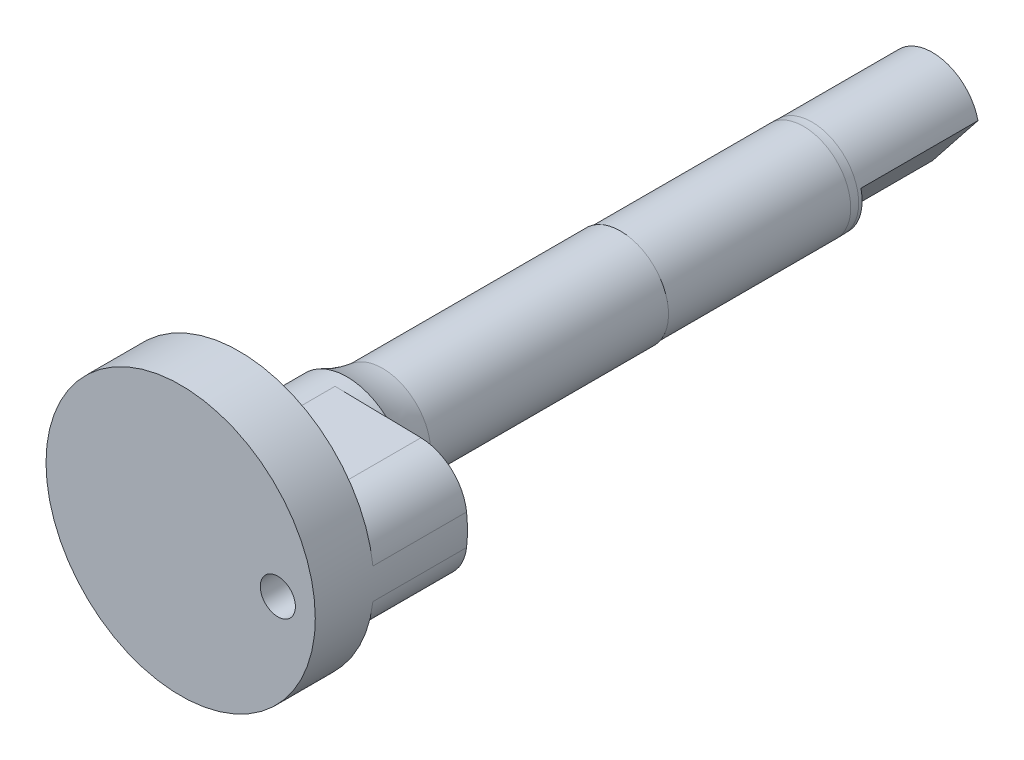
from build123d import *

# Parameters (mm, degrees)
SKETCH1_R               = 5
BOSS_EXTRUDE1_DEPTH     = 100
SKETCH2_R               = 11.5
BOSS_EXTRUDE2_DEPTH     = 5
SKETCH3_R               = 1.5
BOSS_EXTRUDE3_DEPTH     = 5
BOSS_EXTRUDE4_START     = 8
BOSS_EXTRUDE4_DEPTH     = 8
CUT_EXTRUDE2_DEPTH      = 8
CUT_EXTRUDE4_DEPTH      = 134.839635872
CUT_EXTRUDE4_DEPTH_BACK = 134.839635872
SKETCH7_W               = 13.423809299
SKETCH7_H               = 65.791523209
CUT_EXTRUDE5_DEPTH      = 48.105089111
CUT_EXTRUDE5_DEPTH_BACK = 48.105089111
SKETCH8_R               = 1.5
SKETCH9_R               = 5
SKETCH9_R_2             = 4.025
CUT_EXTRUDE6_DEPTH      = 25
FILLET1_R               = 10
BOSS_EXTRUDE5_START     = 25
SKETCH10_R              = 4.025
BOSS_EXTRUDE5_DEPTH     = 25
CUT_EXTRUDE7_DEPTH      = 10
SKETCH12_R              = 4.025
SKETCH12_R_2            = 4
CUT_EXTRUDE8_DEPTH      = 11
FILLET2_R               = 10
SKETCH13_R              = 4.105
SKETCH13_R_2            = 4.025
BOSS_EXTRUDE6_DEPTH     = 20
BOSS_EXTRUDE7_START     = 5
SKETCH14_R              = 4.105
BOSS_EXTRUDE7_DEPTH     = 5


with BuildPart() as part:
    # Sketch1 → Boss-Extrude1 (new body)
    with BuildSketch(Plane.XY):
        Circle(SKETCH1_R)
    extrude(amount=BOSS_EXTRUDE1_DEPTH)

    # Sketch2 → Boss-Extrude2 (add)
    with BuildSketch(Plane.XY.offset(100)):
        Circle(SKETCH2_R)
    extrude(amount=BOSS_EXTRUDE2_DEPTH)

    # Sketch3 → Boss-Extrude3 (add)
    with BuildSketch(Plane.XY.offset(105)):
        with Locations((8.302947015, 0)):
            Circle(SKETCH3_R)
    extrude(amount=BOSS_EXTRUDE3_DEPTH)

    # Sketch5 → Boss-Extrude4 (add)
    with BuildSketch(Plane(origin=(0, 0, 100), x_dir=(-1, 0, 0), z_dir=(0, 0, -1)).offset(BOSS_EXTRUDE4_START)):
        with BuildLine():
            Line((-10.45001903, 4.800739762), (0, 5))
            ThreePointArc((0, 5), (4.99977072, -0.04788268), (-0.095760969, -4.9990829))
            Line((-0.095760969, -4.9990829), (-10.45001903, -4.800739762))
            ThreePointArc((-10.45001903, -4.800739762), (-11.5, 0), (-10.45001903, 4.800739762))
        make_face()
    extrude(amount=-BOSS_EXTRUDE4_DEPTH)

    # Sketch6 → Cut-Extrude2 (cut)
    with BuildSketch(Plane(origin=(0, 0, 92), x_dir=(-1, 0, 0), z_dir=(0, 0, -1))):
        with BuildLine():
            ThreePointArc((-11.187749919, 2.661625773), (-11.326245042, 1.991525355), (-11.424640936, 1.314374177))
            ThreePointArc((-11.424640936, 1.314374177), (-10.141082355, 3.817380419), (-7.527110609, 4.856473577))
            Line((-7.527110609, 4.856473577), (-10.45001903, 4.800739762))
            ThreePointArc((-10.45001903, 4.800739762), (-10.871624232, 3.749371489), (-11.187749919, 2.661625773))
        make_face()
        with BuildLine():
            ThreePointArc((-11.424595573, -1.314768419), (-10.141131578, -3.817565911), (-7.527431975, -4.856723984))
            Line((-7.527431975, -4.856723984), (-10.45001903, -4.800739762))
            ThreePointArc((-10.45001903, -4.800739762), (-11.07531896, -3.09633815), (-11.424595573, -1.314768419))
        make_face()
    extrude(amount=-CUT_EXTRUDE2_DEPTH, mode=Mode.SUBTRACT)

    # Sketch7 → Cut-Extrude4 (cut, two sides: drawn at the far end of the back side and taken through both)
    with BuildSketch(Plane(origin=(-96.480203858, -4.620399557, 77.417416795), x_dir=(0.40721461787547164, -0.9133324996892062, 6.240488345448587e-15), z_dir=(0.9133324996892062, 0.40721461787547164, -3.9305527970726e-15)).offset(-CUT_EXTRUDE4_DEPTH_BACK)):
        with Locations((36.58009292, 44.521655191)):
            Rectangle(SKETCH7_W, SKETCH7_H)
    extrude(amount=CUT_EXTRUDE4_DEPTH + CUT_EXTRUDE4_DEPTH_BACK, mode=Mode.SUBTRACT)

    # Sketch8 → Cut-Extrude5 (cut, two sides: drawn at the far end of the back side and taken through both)
    with BuildSketch(Plane.XY.offset(110).offset(-CUT_EXTRUDE5_DEPTH_BACK)):
        with Locations((8.302947015, 0)):
            Circle(SKETCH8_R)
    extrude(amount=CUT_EXTRUDE5_DEPTH + CUT_EXTRUDE5_DEPTH_BACK, mode=Mode.SUBTRACT)

    # Sketch9 → Cut-Extrude6 (cut)
    with BuildSketch(Plane(origin=(0, 0, 65.791523209), x_dir=(-1, 0, 0), z_dir=(0, 0, -1))):
        with Locations(Location((0, 0, 0), (0, 0, 90))):
            Circle(SKETCH9_R)
        with Locations(Location((0, 0, 0), (0, 0, 90))):
            Circle(SKETCH9_R_2, mode=Mode.SUBTRACT)
    extrude(amount=-CUT_EXTRUDE6_DEPTH, mode=Mode.SUBTRACT)

    # Fillet1
    # the kernel refuses this fillet: 10 mm, written as the material it adds along each edge
    with BuildSketch(Plane(origin=(0, 0, 90.791523209), x_dir=(0, 1, 0), z_dir=(-1, 0, 0))) as fillet1_piece_1:
        with BuildLine():
            CenterArc((14.025, 4.306898536), FILLET1_R, 180, 25.511347951)
            Line((4.025, 4.306898536), (3.825, 4.306898536))
            Line((3.825, 4.306898536), (3.825, 0))
            Line((3.825, 0), (4.025, -0.2))
            ThreePointArc((4.025, -0.2), (4.5125, -0.2), (4.8195, -0.086137971))
            Line((4.8195, -0.086137971), (5, 0))
        make_face()
    revolve(axis=Axis((0, 0, 90.791523209), (0, 0, -1)))

    # Sketch10 → Boss-Extrude5 (add)
    with BuildSketch(Plane(origin=(0, 0, 65.791523209), x_dir=(-1, 0, 0), z_dir=(0, 0, -1)).offset(BOSS_EXTRUDE5_START)):
        with Locations(Location((0, 0, 0), (0, 0, 90))):
            Circle(SKETCH10_R)
    extrude(amount=-BOSS_EXTRUDE5_DEPTH)

    # Sketch11 → Cut-Extrude7 (cut)
    with BuildSketch(Plane(origin=(0, 0, 40.791523209), x_dir=(-1, 0, 0), z_dir=(0, 0, -1))):
        with BuildLine():
            Line((0, -4.025), (-3.918585251, 0.919409938))
            ThreePointArc((-3.918585251, 0.919409938), (-3.154461127, -2.5), (0, -4.025))
        make_face()
    extrude(amount=-CUT_EXTRUDE7_DEPTH, mode=Mode.SUBTRACT)

    # Sketch12 → Cut-Extrude8 (cut)
    with BuildSketch(Plane(origin=(0, 0, 40.791523209), x_dir=(-1, 0, 0), z_dir=(0, 0, -1))):
        with Locations(Location((0, 0, 0), (0, 0, 90))):
            Circle(SKETCH12_R)
        with Locations(Location((0, 0, 0), (0, 0, 90))):
            Circle(SKETCH12_R_2, mode=Mode.SUBTRACT)
    extrude(amount=-CUT_EXTRUDE8_DEPTH, mode=Mode.SUBTRACT)

    # Fillet2
    # the kernel refuses this fillet: 10 mm, written as the material it adds along each edge
    with BuildSketch(Plane(origin=(0, 0, 51.791523209), x_dir=(0, 1, 0), z_dir=(-1, 0, 0))) as fillet2_piece_1:
        with BuildLine():
            CenterArc((14, 0.706664701), FILLET2_R, 180, 4.052267945)
            Line((4, 0.706664701), (4, 0))
            Line((4, 0), (4.025, 0))
        make_face()
    revolve(axis=Axis((0, 0, 51.791523209), (0, 0, -1)))

    # Sketch13 → Boss-Extrude6 (add)
    with BuildSketch(Plane(origin=(0, 0, 72.432039474), x_dir=(-1, 0, 0), z_dir=(0, 0, -1))):
        with Locations(Location((0, 0, 0), (0, 0, 90))):
            Circle(SKETCH13_R)
        with Locations(Location((0, 0, 0), (0, 0, 90))):
            Circle(SKETCH13_R_2, mode=Mode.SUBTRACT)
    extrude(amount=-BOSS_EXTRUDE6_DEPTH)

    # Sketch14 → Boss-Extrude7 (add)
    with BuildSketch(Plane(origin=(0, 0, 72.432039474), x_dir=(-1, 0, 0), z_dir=(0, 0, -1)).offset(BOSS_EXTRUDE7_START)):
        with Locations(Location((0, 0, 0), (0, 0, 90))):
            Circle(SKETCH14_R)
    extrude(amount=-BOSS_EXTRUDE7_DEPTH)


solid = part.part
